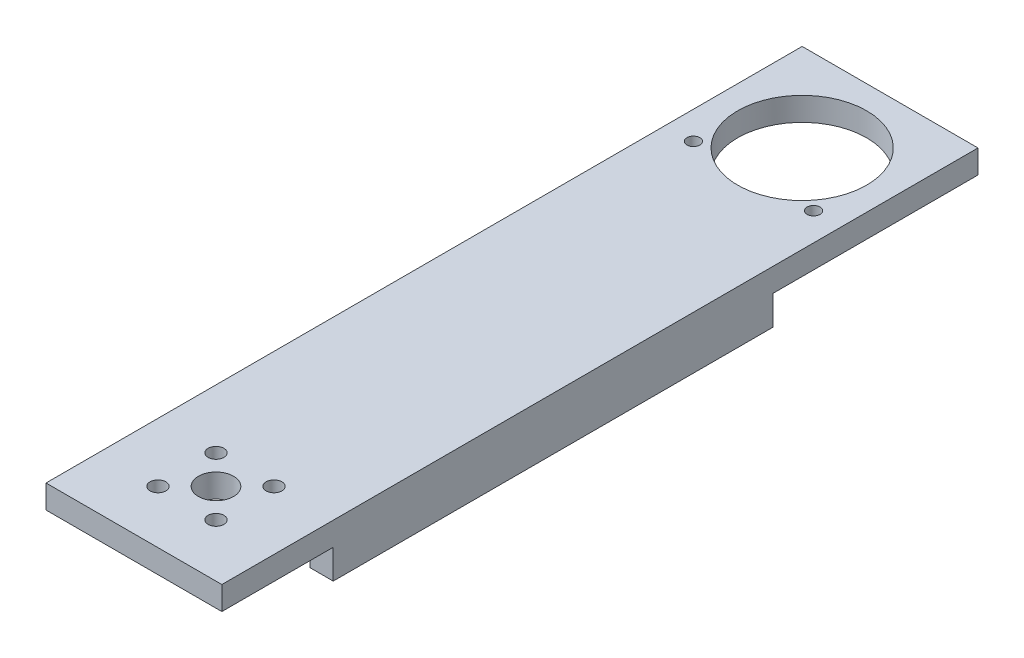
from build123d import *

# Parameters (mm, degrees)
S_BOX1_W      = 30
S_BOX1_H      = 4
BOSS_1_DEPTH  = 129
S_BOX2_W      = 4
S_BOX2_H      = 5.5
BOSS_2_DEPTH  = 75
S_BOX3_W      = 4
S_BOX3_H      = 5.5
BOSS_3_DEPTH  = 75
S_HOLE4_R     = 3
HOLE_4_DEPTH  = 4.2
S_HOLE5_R     = 1.35
HOLE_5_DEPTH  = 4.2
S_HOLE6_R     = 1.35
HOLE_6_DEPTH  = 4.2
S_HOLE7_R     = 1.35
HOLE_7_DEPTH  = 4.2
S_HOLE8_R     = 1.35
HOLE_8_DEPTH  = 4.2
S_HOLE9_R     = 11
HOLE_9_DEPTH  = 4.2
S_HOLE10_R    = 1.1
HOLE_10_DEPTH = 4.2
S_HOLE11_R    = 1.1
HOLE_11_DEPTH = 4.2
S_HOLE12_R    = 1.1
HOLE_12_DEPTH = 4.2
S_HOLE13_R    = 1.1
HOLE_13_DEPTH = 4.2


with BuildPart() as part:
    # S_box1 → Boss_1 (new body)
    with BuildSketch(Plane.XY.offset(-115)):
        with Locations((0, -20.625)):
            Rectangle(S_BOX1_W, S_BOX1_H)
    extrude(amount=BOSS_1_DEPTH)

    # S_box2 → Boss_2 (add)
    with BuildSketch(Plane.XY.offset(-80)):
        with Locations((-13, -24.875)):
            Rectangle(S_BOX2_W, S_BOX2_H)
    extrude(amount=BOSS_2_DEPTH)

    # S_box3 → Boss_3 (add)
    with BuildSketch(Plane.XY.offset(-80)):
        with Locations((13, -24.875)):
            Rectangle(S_BOX3_W, S_BOX3_H)
    extrude(amount=BOSS_3_DEPTH)

    # S_hole4 → Hole_4 (cut)
    with BuildSketch(Plane(origin=(0, -22.725, 0), x_dir=(1, 0, 0), z_dir=(0, 1, 0))):
        Circle(S_HOLE4_R)
    extrude(amount=HOLE_4_DEPTH, mode=Mode.SUBTRACT)

    # S_hole5 → Hole_5 (cut)
    with BuildSketch(Plane(origin=(0, -22.725, 0), x_dir=(1, 0, 0), z_dir=(0, 1, 0))):
        with Locations((4.949747468, -4.949747468)):
            Circle(S_HOLE5_R)
    extrude(amount=HOLE_5_DEPTH, mode=Mode.SUBTRACT)

    # S_hole6 → Hole_6 (cut)
    with BuildSketch(Plane(origin=(0, -22.725, 0), x_dir=(1, 0, 0), z_dir=(0, 1, 0))):
        with Locations((-4.949747468, -4.949747468)):
            Circle(S_HOLE6_R)
    extrude(amount=HOLE_6_DEPTH, mode=Mode.SUBTRACT)

    # S_hole7 → Hole_7 (cut)
    with BuildSketch(Plane(origin=(0, -22.725, 0), x_dir=(1, 0, 0), z_dir=(0, 1, 0))):
        with Locations((-4.949747468, 4.949747468)):
            Circle(S_HOLE7_R)
    extrude(amount=HOLE_7_DEPTH, mode=Mode.SUBTRACT)

    # S_hole8 → Hole_8 (cut)
    with BuildSketch(Plane(origin=(0, -22.725, 0), x_dir=(1, 0, 0), z_dir=(0, 1, 0))):
        with Locations((4.949747468, 4.949747468)):
            Circle(S_HOLE8_R)
    extrude(amount=HOLE_8_DEPTH, mode=Mode.SUBTRACT)

    # S_hole9 → Hole_9 (cut)
    with BuildSketch(Plane(origin=(0, -22.725, 0), x_dir=(1, 0, 0), z_dir=(0, 1, 0))):
        with Locations((0, 100)):
            Circle(S_HOLE9_R)
    extrude(amount=HOLE_9_DEPTH, mode=Mode.SUBTRACT)

    # S_hole10 → Hole_10 (cut)
    with BuildSketch(Plane(origin=(0, -22.725, 0), x_dir=(1, 0, 0), z_dir=(0, 1, 0))):
        with Locations((-10.25, 91.7)):
            Circle(S_HOLE10_R)
    extrude(amount=HOLE_10_DEPTH, mode=Mode.SUBTRACT)

    # S_hole11 → Hole_11 (cut)
    with BuildSketch(Plane(origin=(0, -22.725, 0), x_dir=(1, 0, 0), z_dir=(0, 1, 0))):
        with Locations((10.25, 91.7)):
            Circle(S_HOLE11_R)
    extrude(amount=HOLE_11_DEPTH, mode=Mode.SUBTRACT)

    # S_hole12 → Hole_12 (cut)
    with BuildSketch(Plane(origin=(0, -22.725, 0), x_dir=(1, 0, 0), z_dir=(0, 1, 0))):
        with Locations((-10.25, 67.25)):
            Circle(S_HOLE12_R)
    extrude(amount=-HOLE_12_DEPTH, mode=Mode.SUBTRACT)

    # S_hole13 → Hole_13 (cut)
    with BuildSketch(Plane(origin=(0, -22.725, 0), x_dir=(1, 0, 0), z_dir=(0, 1, 0))):
        with Locations((10.25, 67.25)):
            Circle(S_HOLE13_R)
    extrude(amount=-HOLE_13_DEPTH, mode=Mode.SUBTRACT)


solid = part.part
